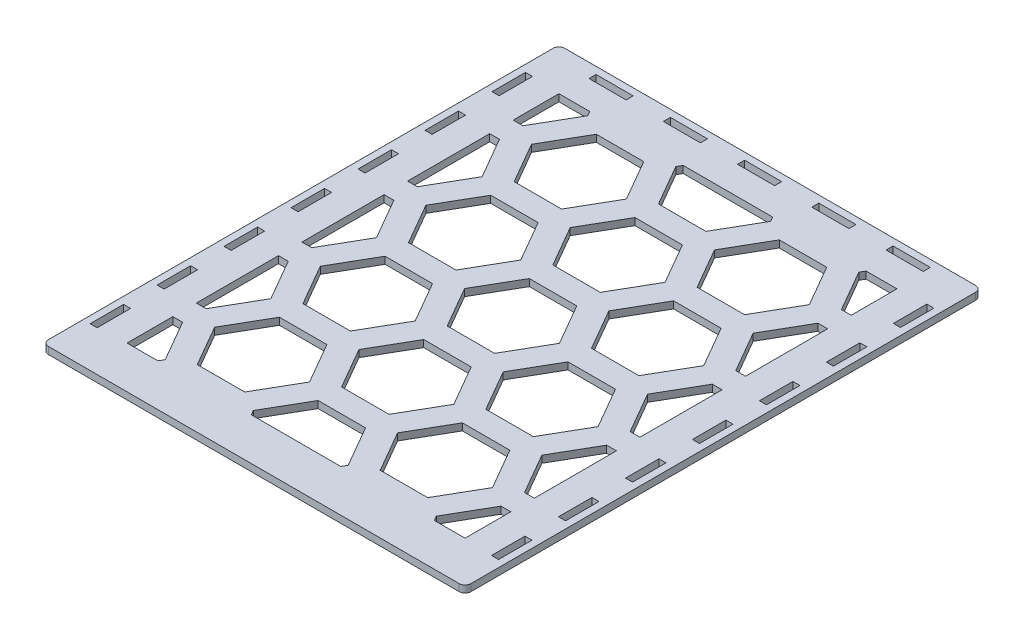
from build123d import *

# Parameters (mm, degrees)
SKETCH1_W               = 180
SKETCH1_H               = 220
BOSS_EXTRUDE1_DEPTH     = 3
CUT_EXTRUDE1_DEPTH      = 143.158362399
CUT_EXTRUDE1_DEPTH_BACK = 143.158362399
SKETCH2_W               = 15.818181818
SKETCH2_H               = 3
SKETCH2_W_2             = 3
SKETCH2_H_2             = 14.266666667
SKETCH2_H_3             = 14.266666666
FILLET1_R               = 2.5
CUT_EXTRUDE3_DEPTH      = 143.158362399
CUT_EXTRUDE3_DEPTH_BACK = 143.158362399


with BuildPart() as part:
    # Sketch1 → Boss-Extrude1 (new body)
    with BuildSketch(Plane(origin=(0, 0, 0), x_dir=(1, 0, 0), z_dir=(0, 1, 0))):
        Rectangle(SKETCH1_W, SKETCH1_H)
    extrude(amount=BOSS_EXTRUDE1_DEPTH)

    # Sketch2 → Cut-Extrude1 (cut, two sides: drawn at the far end of the back side and taken through both)
    with BuildSketch(Plane(origin=(0, 3, 0), x_dir=(1, 0, 0), z_dir=(0, 1, 0)).offset(-CUT_EXTRUDE1_DEPTH_BACK)):
        with Locations((0, 105.5)):
            Rectangle(SKETCH2_W, SKETCH2_H)
        with Locations((31.636363636, 105.5)):
            Rectangle(SKETCH2_W, SKETCH2_H)
        with Locations((63.272727273, 105.5)):
            Rectangle(SKETCH2_W, SKETCH2_H)
        with Locations((85.5, -57.066666666)):
            Rectangle(SKETCH2_W_2, SKETCH2_H_2)
        with Locations((-31.636363636, 105.5)):
            Rectangle(SKETCH2_W, SKETCH2_H)
        with Locations((-63.272727273, 105.5)):
            Rectangle(SKETCH2_W, SKETCH2_H)
        with Locations((85.5, -85.6)):
            Rectangle(SKETCH2_W_2, SKETCH2_H_3)
        with Locations((-85.5, 85.6)):
            Rectangle(SKETCH2_W_2, SKETCH2_H_3)
        with Locations((-85.5, 57.066666666)):
            Rectangle(SKETCH2_W_2, SKETCH2_H_2)
        with Locations((-85.5, 28.533333334)):
            Rectangle(SKETCH2_W_2, SKETCH2_H_2)
        with Locations((-85.5, 0)):
            Rectangle(SKETCH2_W_2, SKETCH2_H_3)
        with Locations((85.5, 85.6)):
            Rectangle(SKETCH2_W_2, SKETCH2_H_3)
        with Locations((85.5, 57.066666666)):
            Rectangle(SKETCH2_W_2, SKETCH2_H_2)
        with Locations((85.5, 28.533333334)):
            Rectangle(SKETCH2_W_2, SKETCH2_H_2)
        with Locations((85.5, 0)):
            Rectangle(SKETCH2_W_2, SKETCH2_H_3)
        with Locations((85.5, -28.533333334)):
            Rectangle(SKETCH2_W_2, SKETCH2_H_2)
        with Locations((-85.5, -28.533333334)):
            Rectangle(SKETCH2_W_2, SKETCH2_H_2)
        with Locations((-85.5, -57.066666666)):
            Rectangle(SKETCH2_W_2, SKETCH2_H_2)
        with Locations((-85.5, -85.6)):
            Rectangle(SKETCH2_W_2, SKETCH2_H_3)
    extrude(amount=CUT_EXTRUDE1_DEPTH + CUT_EXTRUDE1_DEPTH_BACK, mode=Mode.SUBTRACT)

    # Fillet1
    fillet1_edges = [part.edges().sort_by_distance(p)[0] for p in [
        (-90, 1.5, -110),
        (90, 1.5, -110),
        (90, 1.5, 110),
        (-90, 1.5, 110),
    ]]
    fillet(fillet1_edges, radius=FILLET1_R)

    # Sketch3 → Cut-Extrude3 (cut, two sides: drawn at the far end of the back side and taken through both)
    with BuildSketch(Plane(origin=(0, 0, 0), x_dir=(1, 0, 0), z_dir=(0, 1, 0)).offset(-CUT_EXTRUDE3_DEPTH_BACK)):
        Polygon((-57.735026919, 90), (-58.889727457, 92), (-72, 92), (-72, 72.5), (-67.83865663, 72.5), align=None)
        Polygon((19.052558883, 92), (-19.052558883, 92), (-20.207259422, 90), (-10.103629711, 72.5), (10.103629711, 72.5), (20.207259422, 90), align=None)
        Polygon((-67.83865663, 62.5), (-72, 62.5), (-72, 27.5), (-67.83865663, 27.5), (-57.735026919, 45), align=None)
        Polygon((72, 92), (58.889727457, 92), (57.735026919, 90), (67.83865663, 72.5), (72, 72.5), align=None)
        Polygon((-67.83865663, 17.5), (-72, 17.5), (-72, -17.5), (-67.83865663, -17.5), (-57.735026919, 0), align=None)
        Polygon((72, 27.5), (72, 62.5), (67.83865663, 62.5), (57.735026919, 45), (67.83865663, 27.5), align=None)
        Polygon((-67.83865663, -27.5), (-72, -27.5), (-72, -62.5), (-67.83865663, -62.5), (-57.735026919, -45), align=None)
        Polygon((72, -17.5), (72, 17.5), (67.83865663, 17.5), (57.735026919, 0), (67.83865663, -17.5), align=None)
        Polygon((-67.83865663, -72.5), (-72, -72.5), (-72, -92), (-58.889727457, -92), (-57.735026919, -90), align=None)
        Polygon((72, -62.5), (72, -27.5), (67.83865663, -27.5), (57.735026919, -45), (67.83865663, -62.5), align=None)
        Polygon((-20.207259422, -90), (-19.052558883, -92), (19.052558883, -92), (20.207259422, -90), (10.103629711, -72.5), (-10.103629711, -72.5), align=None)
        Polygon((72, -92), (72, -72.5), (67.83865663, -72.5), (57.735026919, -90), (58.889727457, -92), align=None)
        Polygon((-49.074772881, -5), (-59.178402592, -22.5), (-49.074772881, -40), (-28.867513459, -40), (-18.763883749, -22.5), (-28.867513459, -5), align=None)
        Polygon((-49.074772881, -50), (-59.178402592, -67.5), (-49.074772881, -85), (-28.867513459, -85), (-18.763883749, -67.5), (-28.867513459, -50), align=None)
        Polygon((-49.074772881, 40), (-59.178402592, 22.5), (-49.074772881, 5), (-28.867513459, 5), (-18.763883749, 22.5), (-28.867513459, 40), align=None)
        Polygon((-49.074772881, 85), (-59.178402592, 67.5), (-49.074772881, 50), (-28.867513459, 50), (-18.763883749, 67.5), (-28.867513459, 85), align=None)
        Polygon((20.207259422, 45), (10.103629711, 62.5), (-10.103629711, 62.5), (-20.207259422, 45), (-10.103629711, 27.5), (10.103629711, 27.5), align=None)
        Polygon((20.207259422, 0), (10.103629711, 17.5), (-10.103629711, 17.5), (-20.207259422, 0), (-10.103629711, -17.5), (10.103629711, -17.5), align=None)
        Polygon((28.867513459, -5), (18.763883749, -22.5), (28.867513459, -40), (49.074772881, -40), (59.178402592, -22.5), (49.074772881, -5), align=None)
        Polygon((20.207259422, -45), (10.103629711, -27.5), (-10.103629711, -27.5), (-20.207259422, -45), (-10.103629711, -62.5), (10.103629711, -62.5), align=None)
        Polygon((28.867513459, -50), (18.763883749, -67.5), (28.867513459, -85), (49.074772881, -85), (59.178402592, -67.5), (49.074772881, -50), align=None)
        Polygon((28.867513459, 40), (18.763883749, 22.5), (28.867513459, 5), (49.074772881, 5), (59.178402592, 22.5), (49.074772881, 40), align=None)
        Polygon((28.867513459, 85), (18.763883749, 67.5), (28.867513459, 50), (49.074772881, 50), (59.178402592, 67.5), (49.074772881, 85), align=None)
    extrude(amount=CUT_EXTRUDE3_DEPTH + CUT_EXTRUDE3_DEPTH_BACK, mode=Mode.SUBTRACT)


solid = part.part
